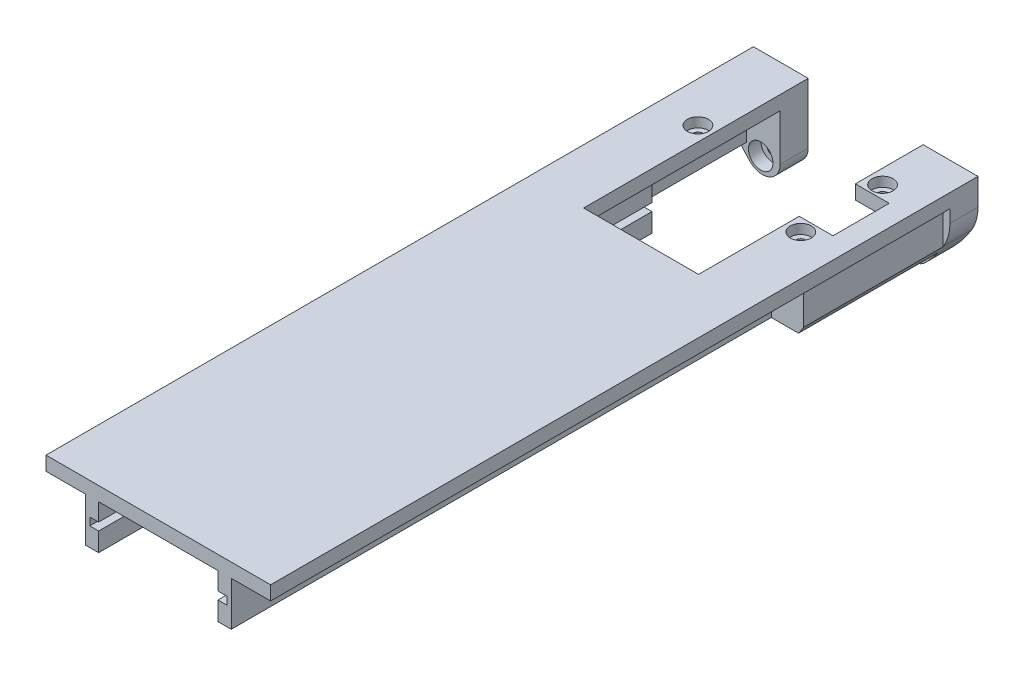
from build123d import *

# Parameters (mm, degrees)
SKETCH1_W                                     = 50.8
SKETCH1_H                                     = 25.4
BASE_FLANGE1_DEPTH                            = 6.35
SKETCH22_W                                    = 50.8
SKETCH22_H                                    = 160
BOSS_EXTRUDE1_DEPTH                           = 3.175
GUSSET1_START                                 = -22.225
GUSSET1_DEPTH                                 = 1.5875
CBORE_FOR_4_SOCKET_HEAD_CAP_SCREW1_AT_2_COUNT = 2
CBORE_FOR_4_SOCKET_HEAD_CAP_SCREW1_AT_2_PITCH = 34.798
SKETCH12_W                                    = 26
SKETCH12_H                                    = 28.575
CUT_EXTRUDE1_DEPTH                            = 50.8
SKETCH13_W                                    = 33.6375
SKETCH13_H                                    = 12.7
CUT_EXTRUDE2_DEPTH                            = 50.8
CBORE_FOR_2_SOCKET_HEAD_CAP_SCREW1_AT_2_COUNT = 2
CBORE_FOR_2_SOCKET_HEAD_CAP_SCREW1_AT_2_PITCH = 33.801054175
CBORE_FOR_2_SOCKET_HEAD_CAP_SCREW1_AT_3_COUNT = 2
CBORE_FOR_2_SOCKET_HEAD_CAP_SCREW1_AT_3_PITCH = 33.801054175
EXTRUDE_THIN1_DEPTH                           = 10
SKETCH25_W                                    = 3.175
SKETCH25_H                                    = 31.5
EXTRUDE_THIN2_DEPTH                           = 10
SKETCH17_OUTSIDE_W                            = 86.756
SKETCH17_OUTSIDE_H                            = 61.356
SKETCH17_OUTSIDE_R                            = 27.94
CUT_EXTRUDE3_DEPTH                            = 165.504378741
FILLET1_R                                     = 10
FILLET2_R                                     = 4
SKETCH24_W                                    = 31
SKETCH24_H                                    = 1.75
CUT_EXTRUDE4_DEPTH                            = 125.15


# Read off the part's stored shape, not the designer's step: Gusset1
# Sheet-metal steps are written as plain solids
with BuildPart() as part:
    # Sketch1 → Base-Flange1 (new body)
    with BuildSketch(Plane.XY):
        with Locations((0, -15.875)):
            Rectangle(SKETCH1_W, SKETCH1_H)
    extrude(amount=-BASE_FLANGE1_DEPTH)

    # Sketch22 → Boss-Extrude1 (add)
    with BuildSketch(Plane(origin=(0, -3.175, 0), x_dir=(1, 0, 0), z_dir=(0, 1, 0))):
        with Locations((0, -73.65)):
            Rectangle(SKETCH22_W, SKETCH22_H)
    extrude(amount=-BOSS_EXTRUDE1_DEPTH)

    # Sketch11 → CBORE for #4 Socket Head Cap Screw1 (revolve, cut)
    with BuildSketch(Plane(origin=(-17.399, -17.4, 0), x_dir=(0, -1, 0), z_dir=(1, 0, 0))):
        Polygon((0, 0), (0, 6.351), (1.4732, 6.351), (1.4732, 2.8448), (2.77876, 2.8448), (2.77876, 0), align=None)
    cbore_for_4_socket_head_cap_screw1 = revolve(axis=Axis((-17.399, -17.4, 6.35), (0, 0, -1)), mode=Mode.SUBTRACT)

    # CBORE for #4 Socket Head Cap Screw1 at 2: CBORE for #4 Socket Head Cap Screw1 ×2
    with Locations(*[(i * CBORE_FOR_4_SOCKET_HEAD_CAP_SCREW1_AT_2_PITCH, 0, 0) for i in range(1, CBORE_FOR_4_SOCKET_HEAD_CAP_SCREW1_AT_2_COUNT)]):
        add(cbore_for_4_socket_head_cap_screw1, mode=Mode.SUBTRACT)

    # Sketch12 → Cut-Extrude1 (cut)
    with BuildSketch(Plane(origin=(0, 0, -6.35), x_dir=(-1, 0, 0), z_dir=(0, 0, -1))):
        with Locations((0, -14.2875)):
            Rectangle(SKETCH12_W, SKETCH12_H)
    extrude(amount=-CUT_EXTRUDE1_DEPTH, mode=Mode.SUBTRACT)


with BuildPart() as body_2:
    # Gusset1 outline → Gusset1 (new body)
    with BuildSketch(Plane.YZ.offset(GUSSET1_START)):
        Polygon((-16.35, 5), (-16.35, 0), (-6.35, 0), (-6.35, 30), (-10.35, 30), align=None)
    gusset1 = extrude(amount=GUSSET1_DEPTH)


with BuildPart() as part_1:
    add(part.part)

    # Mirror2: Gusset1 across plane
    add(gusset1.mirror(Plane(origin=(0, 0, 0), x_dir=(0, 0, 1), z_dir=(1, 0, 0))))

    # Sketch13 → Cut-Extrude2 (cut)
    with BuildSketch(Plane.XZ.offset(6.35)):
        with Locations((3.81875, 15.335)):
            Rectangle(SKETCH13_W, SKETCH13_H)
    extrude(amount=-CUT_EXTRUDE2_DEPTH, mode=Mode.SUBTRACT)

    # Sketch16 → CBORE for #2 Socket Head Cap Screw1 (revolve, cut)
    with BuildSketch(Plane(origin=(-16.256, -3.175, 15.335), x_dir=(0, 0, 1), z_dir=(1, 0, 0))):
        Polygon((0, 0), (0, 17.242569267), (1.2192, 16.51), (1.2192, 2.1844), (2.38125, 2.1844), (2.38125, 0), align=None)
    cbore_for_2_socket_head_cap_screw1 = revolve(axis=Axis((-16.256, 3.175, 15.335), (0, -1, 0)), mode=Mode.SUBTRACT)

    # CBORE for #2 Socket Head Cap Screw1 at 2: CBORE for #2 Socket Head Cap Screw1 ×2
    with Locations(*[Vector(0.9618634919315714, 0, 0.27352993051804053) * (i * CBORE_FOR_2_SOCKET_HEAD_CAP_SCREW1_AT_2_PITCH) for i in range(1, CBORE_FOR_2_SOCKET_HEAD_CAP_SCREW1_AT_2_COUNT)]):
        add(cbore_for_2_socket_head_cap_screw1, mode=Mode.SUBTRACT)

    # CBORE for #2 Socket Head Cap Screw1 at 3: CBORE for #2 Socket Head Cap Screw1 ×2
    with Locations(*[Vector(0.9618634919315714, 0, -0.2735299305180405) * (i * CBORE_FOR_2_SOCKET_HEAD_CAP_SCREW1_AT_3_PITCH) for i in range(1, CBORE_FOR_2_SOCKET_HEAD_CAP_SCREW1_AT_3_COUNT)]):
        add(cbore_for_2_socket_head_cap_screw1, mode=Mode.SUBTRACT)

    add(body_2.part)  # Extrude-Thin1 merges body 2
    # Sketch23 → Extrude-Thin1 (add)
    with BuildSketch(Plane.XZ.offset(6.35)):
        Polygon((-22.225, 28.5), (-13.5, 28.5), (-13.5, 153.65), (-16.5, 153.65), (-16.5, 31.5), (-22.225, 31.5), align=None)
        Polygon((13.5, 153.65), (13.5, 28.5), (22.225, 28.5), (22.225, 31.5), (16.5, 31.5), (16.5, 153.65), align=None)
    extrude(amount=EXTRUDE_THIN1_DEPTH)

    # Sketch25 → Extrude-Thin2 (add)
    with BuildSketch(Plane.XZ.offset(6.35)):
        with Locations((-22.225, 15.75)):
            Rectangle(SKETCH25_W, SKETCH25_H)
        with Locations((22.225, 15.75)):
            Rectangle(SKETCH25_W, SKETCH25_H)
    extrude(amount=EXTRUDE_THIN2_DEPTH)

    # Sketch17 outside → Cut-Extrude3 (cut, through all)
    with BuildSketch(Plane(origin=(0, 0, -6.35), x_dir=(-1, 0, 0), z_dir=(0, 0, -1))):
        with Locations((0, -15.875)):
            Rectangle(SKETCH17_OUTSIDE_W, SKETCH17_OUTSIDE_H)
        Circle(SKETCH17_OUTSIDE_R, mode=Mode.SUBTRACT)
    extrude(amount=-CUT_EXTRUDE3_DEPTH, mode=Mode.SUBTRACT)

    # Fillet1
    fillet1_edges = [part_1.edges().sort_by_distance(p)[0] for p in [
        (-25.4, -11.639742265, -3.175),
        (25.4, -11.639742265, -3.175),
    ]]
    fillet(fillet1_edges, radius=FILLET1_R)

    # Fillet2
    fillet2_edges = [part_1.edges().sort_by_distance(p)[0] for p in [
        (-13, -24.731429397, -3.175),
        (13, -24.731429397, -3.175),
    ]]
    fillet(fillet2_edges, radius=FILLET2_R)

    # Sketch24 → Cut-Extrude4 (cut)
    with BuildSketch(Plane.XY.offset(153.65)):
        with Locations((0, -11.225)):
            Rectangle(SKETCH24_W, SKETCH24_H)
    extrude(amount=-CUT_EXTRUDE4_DEPTH, mode=Mode.SUBTRACT)


solid = part_1.part
